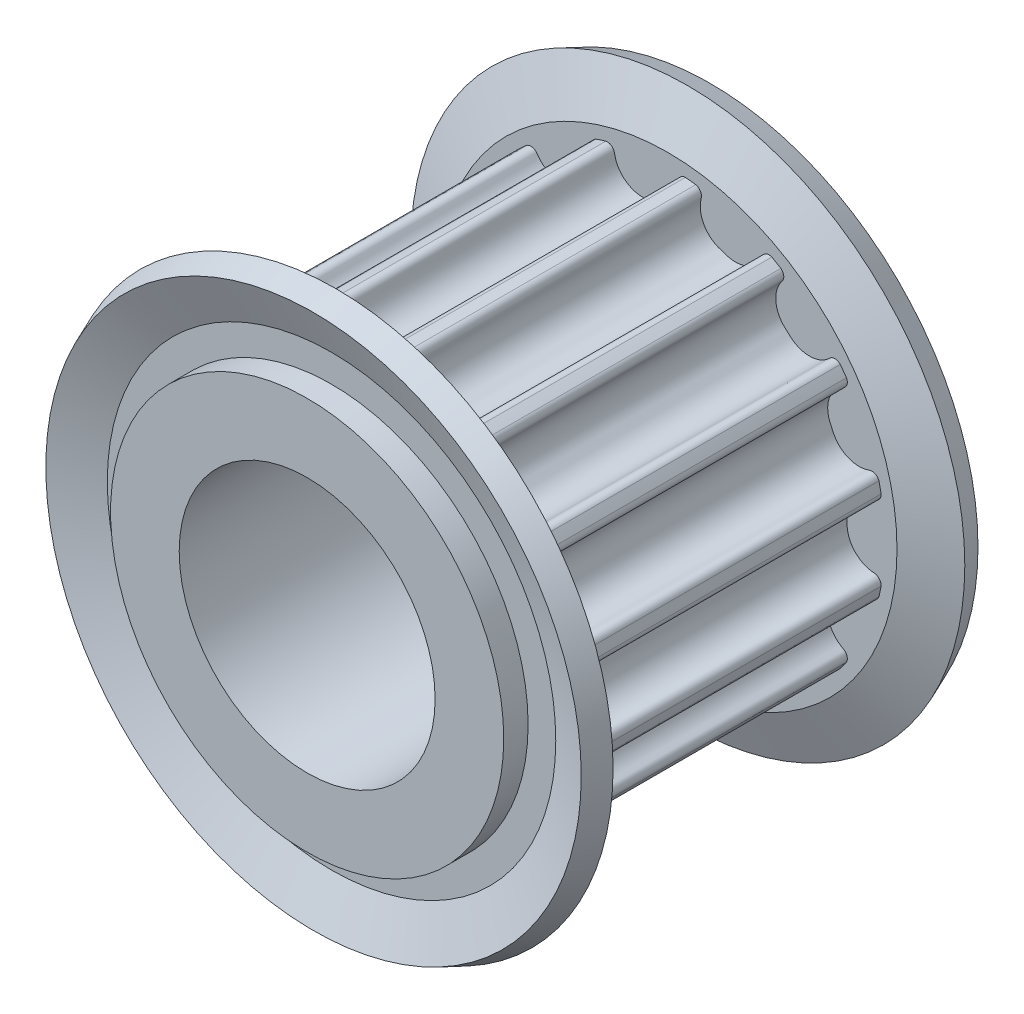
from build123d import *

# Parameters (mm, degrees)
TOOTHEXTRUDECUTGEARBELT01PULLEY_DEPTH = 4.876799927
PATTERNGEARBELT01PULLEY_COUNT         = 15
BOREREVOLVESKETCH_W                   = 12.801599808
BOREREVOLVESKETCH_H                   = 4


with BuildPart() as part:
    # SketchRevolveGearBelt01Pulley → GearBelt01Pulley (revolve)
    with BuildSketch(Plane(origin=(0, 0, 0), x_dir=(0, 0, -1), z_dir=(1, 0, 0))):
        Polygon((6.400799904, 0), (6.400799904, 6.145458216), (5.638799915, 6.145458216), (5.638799915, 7.009886979), (6.201536555, 8.368453407), (5.497540362, 8.660058178), (4.876799927, 7.161458201), (4.876799927, 6.780458207), (-4.876799927, 6.780458207), (-4.876799927, 7.161458201), (-5.497540362, 8.660058178), (-6.201536555, 8.368453407), (-5.638799915, 7.009886979), (-5.638799915, 6.145458216), (-6.400799904, 6.145458216), (-6.400799904, 0), align=None)
    revolve(axis=Axis((0, 0, 0), (0, 0, -1)))

    # SketchToothGearBelt01Pulley → ToothExtrudeCutGearBelt01Pulley (cut, symmetric)
    with BuildSketch(Plane.XY):
        with BuildLine():
            ThreePointArc((6.661096355, 1.272831888), (6.78161527, 0), (6.661096355, -1.272831888))
            add(Edge.make_bspline(
                [(6.661096355, -1.272831888), (6.663615018, -1.259659662), (6.665647801, -1.239568599), (6.664820876, -1.212733988), (6.662437583, -1.192740045), (6.658309361, -1.173032278), (6.652468102, -1.15376267), (6.644958835, -1.135079815), (6.635839471, -1.117127785), (6.625180333, -1.100045019), (6.613063619, -1.083963244), (6.599582765, -1.06900649), (6.584841733, -1.055290043), (6.568954182, -1.042919864), (6.552042687, -1.031990656), (6.534237438, -1.022589264), (6.515676569, -1.014778616), (6.49650012, -1.00865466), (6.476867505, -1.00413133), (6.427750984, -0.998255219), (6.361870769, -0.993498048), (6.280955314, -0.976758348), (6.213857662, -0.957771629), (6.148468462, -0.93346319), (6.085179943, -0.904141421), (6.024383488, -0.869943856), (5.966451939, -0.831092016), (5.9117414, -0.787821543), (5.860587957, -0.740399103), (5.813305895, -0.689115832), (5.770185727, -0.634286865), (5.731492294, -0.576249049), (5.697463629, -0.515358957), (5.668307661, -0.451990704), (5.644207759, -0.386533555), (5.625296172, -0.319389892), (5.611748114, -0.250971402), (5.603426544, -0.18170154), (5.601350103, -0.116556682), (5.601805881, -0.056000917), (5.601665396, 0), (5.601805881, 0.056000917), (5.601350103, 0.116556682), (5.603426544, 0.18170154), (5.611748114, 0.250971402), (5.625296172, 0.319389892), (5.644207759, 0.386533555), (5.668307661, 0.451990704), (5.697463629, 0.515358957), (5.731492294, 0.576249049), (5.770185727, 0.634286865), (5.813305895, 0.689115832), (5.860587957, 0.740399103), (5.9117414, 0.787821543), (5.966451939, 0.831092016), (6.024383488, 0.869943856), (6.085179943, 0.904141421), (6.148468462, 0.93346319), (6.213857662, 0.957771629), (6.280955314, 0.976758348), (6.361870769, 0.993498048), (6.427750984, 0.998255219), (6.476867505, 1.00413133), (6.49650012, 1.00865466), (6.515676569, 1.014778616), (6.534237438, 1.022589264), (6.552042687, 1.031990656), (6.568954182, 1.042919864), (6.584841733, 1.055290043), (6.599582765, 1.06900649), (6.613063619, 1.083963244), (6.625180333, 1.100045019), (6.635839471, 1.117127785), (6.644958835, 1.135079815), (6.652468102, 1.15376267), (6.658309361, 1.173032278), (6.662437583, 1.192740045), (6.664820876, 1.212733988), (6.665647801, 1.239568599), (6.663615018, 1.259659662), (6.661096355, 1.272831888)],
                knots=[0, 0, 0, 0, 0.010832325, 0.016248488, 0.021664651, 0.027080813, 0.032496976, 0.037913139, 0.043329302, 0.048745464, 0.054161627, 0.05957779, 0.064993952, 0.070410115, 0.075826278, 0.08124244, 0.086658603, 0.092074766, 0.097490929, 0.102907091, 0.132017291, 0.150784932, 0.169552572, 0.188320213, 0.207087853, 0.225855493, 0.244623134, 0.263390774, 0.282158415, 0.300926055, 0.319693695, 0.338461336, 0.357228976, 0.375996617, 0.394764257, 0.413531897, 0.432299538, 0.451067178, 0.469834819, 0.484917409, 0.5, 0.515082591, 0.530165181, 0.548932822, 0.567700462, 0.586468103, 0.605235743, 0.624003383, 0.642771024, 0.661538664, 0.680306305, 0.699073945, 0.717841585, 0.736609226, 0.755376866, 0.774144507, 0.792912147, 0.811679787, 0.830447428, 0.849215068, 0.867982709, 0.897092909, 0.902509071, 0.907925234, 0.913341397, 0.91875756, 0.924173722, 0.929589885, 0.935006048, 0.94042221, 0.945838373, 0.951254536, 0.956670698, 0.962086861, 0.967503024, 0.972919187, 0.978335349, 0.983751512, 0.989167675, 1, 1, 1, 1], degree=3))
        make_face()
    toothextrudecutgearbelt01pulley = extrude(amount=TOOTHEXTRUDECUTGEARBELT01PULLEY_DEPTH, both=True, mode=Mode.SUBTRACT)

    # PatternGearBelt01Pulley: ToothExtrudeCutGearBelt01Pulley ×15 about axis
    patterngearbelt01pulley_axis = Axis((0, 0, 55), (0, 0, -1))
    for i in range(1, PATTERNGEARBELT01PULLEY_COUNT):
        add(toothextrudecutgearbelt01pulley.rotate(patterngearbelt01pulley_axis, i * 360 / PATTERNGEARBELT01PULLEY_COUNT), mode=Mode.SUBTRACT)

    # BoreRevolveSketch → BoreRevolveCut (revolve, cut)
    with BuildSketch(Plane(origin=(0, 0, 0), x_dir=(0, 0, -1), z_dir=(1, 0, 0))):
        with Locations((0, 2)):
            Rectangle(BOREREVOLVESKETCH_W, BOREREVOLVESKETCH_H)
    revolve(axis=Axis((0, 0, 0), (0, 0, -1)), mode=Mode.SUBTRACT)


solid = part.part
